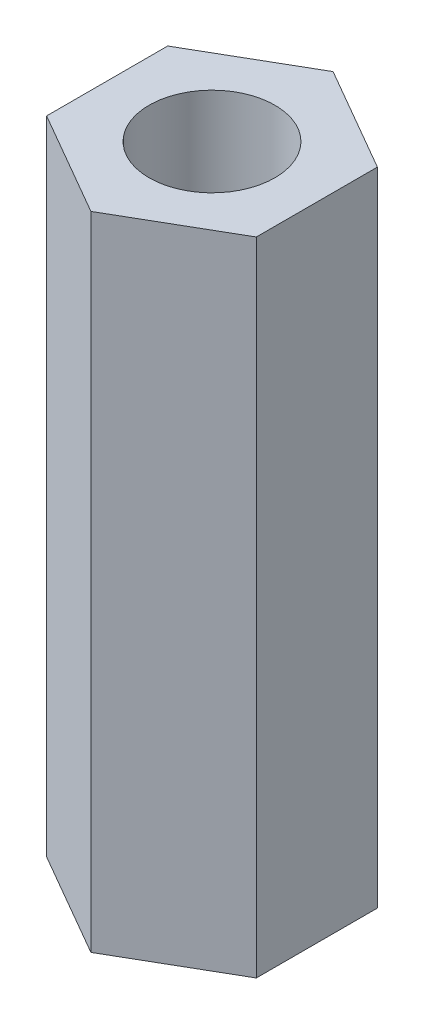
from build123d import *

# Parameters (mm, degrees)
SKETCH_1_R      = 1.5
EXTRUDE_1_DEPTH = 15.3


with BuildPart() as part:
    # 草圖1 → 填料-伸長1 (new body)
    with BuildSketch(Plane(origin=(0, 0, 0), x_dir=(1, 0, 0), z_dir=(0, 1, 0))):
        Polygon((0, 2.886751346), (-2.5, 1.443375673), (-2.5, -1.443375673), (0, -2.886751346), (2.5, -1.443375673), (2.5, 1.443375673), align=None)
        Circle(SKETCH_1_R, mode=Mode.SUBTRACT)
    extrude(amount=EXTRUDE_1_DEPTH)


solid = part.part
